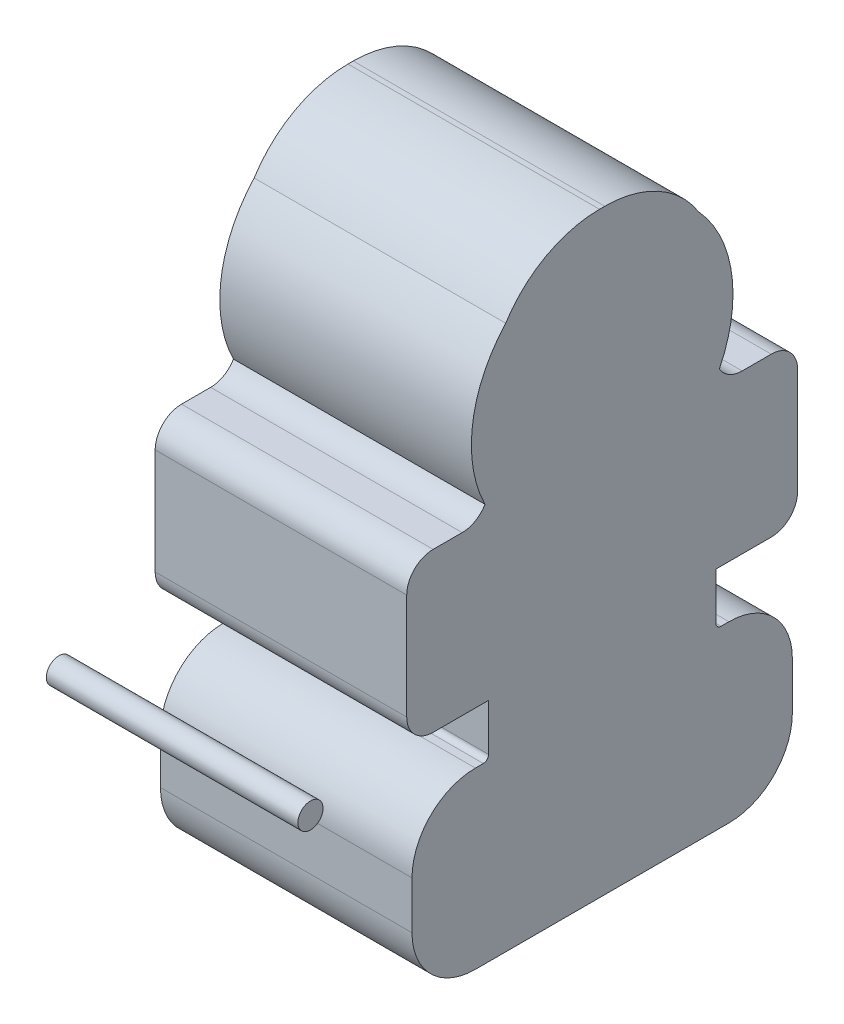
from build123d import *

# Parameters (mm, degrees)
SKETCH1_R             = 101.87
SKETCH1_R_2           = 11
BOSS_EXTRUDE1_DEPTH   = 2
CUT_EXTRUDE1_START    = -2
CUT_EXTRUDE1_DEPTH    = 2
CUT_EXTRUDE2_START    = -2
CUT_EXTRUDE2_DEPTH    = 2
SKETCH4_R             = 26
CUT_EXTRUDE3_DEPTH    = 2
SKETCH5_R             = 2.5
BOSS_EXTRUDE2_DEPTH   = 50
BOSS_EXTRUDE2_2_DEPTH = 50


# Read off the part's stored shape, not the designer's step: Cut-Extrude1, Cut-Extrude2
with BuildPart() as part:
    # Sketch1 → Boss-Extrude1 (new body)
    with BuildSketch(Plane(origin=(0, 0, 0), x_dir=(0, 0, -1), z_dir=(1, 0, 0))):
        Circle(SKETCH1_R)
        Circle(SKETCH1_R_2, mode=Mode.SUBTRACT)
    extrude(amount=BOSS_EXTRUDE1_DEPTH)

    # Cut-Extrude1 outline → Cut-Extrude1 (cut)
    with BuildSketch(Plane(origin=(2, 0, 0), x_dir=(0, 0, -1), z_dir=(1, 0, 0)).offset(CUT_EXTRUDE1_START)):
        with BuildLine():
            Line((96.83, 7.36), (96.83, 28.36))
            ThreePointArc((96.83, 28.36), (95.292310601, 32.072310601), (91.58, 33.61))
            Line((91.58, 33.61), (85.805, 33.61))
            ThreePointArc((85.805, 33.61), (82.092689399, 35.147689399), (80.555, 38.86))
            Line((80.555, 38.86), (80.555, 53.56))
            ThreePointArc((80.555, 53.56), (74.096704525, 69.151704525), (58.505, 75.61))
            Line((58.505, 75.61), (57.455, 75.61))
            ThreePointArc((57.455, 75.61), (41.863295475, 69.151704525), (35.405, 53.56))
            Line((35.405, 53.56), (35.405, 38.86))
            ThreePointArc((35.405, 38.86), (33.867310601, 35.147689399), (30.155, 33.61))
            Line((30.155, 33.61), (24.38, 33.61))
            ThreePointArc((24.38, 33.61), (20.667689399, 32.072310601), (19.13, 28.36))
            Line((19.13, 28.36), (19.13, 7.36))
            ThreePointArc((19.13, 7.36), (20.667689399, 3.647689399), (24.38, 2.11))
            Line((24.38, 2.11), (91.58, 2.11))
            ThreePointArc((91.58, 2.11), (95.292310601, 3.647689399), (96.83, 7.36))
        make_face()
    extrude(amount=CUT_EXTRUDE1_DEPTH, mode=Mode.SUBTRACT)

    # Cut-Extrude2 outline → Cut-Extrude2 (cut)
    with BuildSketch(Plane(origin=(2, 0, 0), x_dir=(0, 0, -1), z_dir=(1, 0, 0)).offset(CUT_EXTRUDE2_START)):
        with BuildLine():
            Line((80.555, 2.11), (35.405, 2.11))
            Line((35.405, 2.11), (35.405, -7.19))
            ThreePointArc((35.405, -7.19), (35.09746212, -7.93246212), (34.355, -8.24))
            Line((34.355, -8.24), (32.78, -8.24))
            ThreePointArc((32.78, -8.24), (23.870454557, -11.930454557), (20.18, -20.84))
            Line((20.18, -20.84), (20.18, -30.29))
            ThreePointArc((20.18, -30.29), (23.870454557, -39.199545443), (32.78, -42.89))
            Line((32.78, -42.89), (83.18, -42.89))
            ThreePointArc((83.18, -42.89), (92.089545443, -39.199545443), (95.78, -30.29))
            Line((95.78, -30.29), (95.78, -20.84))
            ThreePointArc((95.78, -20.84), (92.089545443, -11.930454557), (83.18, -8.24))
            Line((83.18, -8.24), (81.605, -8.24))
            ThreePointArc((81.605, -8.24), (80.86253788, -7.93246212), (80.555, -7.19))
            Line((80.555, -7.19), (80.555, 2.11))
        make_face()
    extrude(amount=CUT_EXTRUDE2_DEPTH, mode=Mode.SUBTRACT)

    # Sketch4 → Cut-Extrude3 (cut)
    with BuildSketch(Plane(origin=(2, 0, 0), x_dir=(0, 0, -1), z_dir=(1, 0, 0))):
        with Locations((57.98, 47.76331228)):
            Circle(SKETCH4_R)
    extrude(amount=-CUT_EXTRUDE3_DEPTH, mode=Mode.SUBTRACT)


with BuildPart() as body_2:
    # Sketch5 → Boss-Extrude2 (new body)
    with BuildSketch(Plane(origin=(2, 0, 0), x_dir=(0, 0, -1), z_dir=(1, 0, 0))):
        Circle(SKETCH5_R)
    extrude(amount=BOSS_EXTRUDE2_DEPTH)


with BuildPart() as body_3:
    # Sketch5 → Boss-Extrude2 2 (new body)
    with BuildSketch(Plane(origin=(2, 0, 0), x_dir=(0, 0, -1), z_dir=(1, 0, 0))):
        with BuildLine():
            ThreePointArc((81.272452679, 36.210752035), (83.724025312, 51.402702438), (77.157360564, 65.31975958))
            ThreePointArc((77.157360564, 65.31975958), (69.156286337, 72.866801894), (58.505, 75.61))
            Line((58.505, 75.61), (57.455, 75.61))
            ThreePointArc((57.455, 75.61), (46.803713663, 72.866801894), (38.802639436, 65.31975958))
            ThreePointArc((38.802639436, 65.31975958), (32.235974688, 51.402702438), (34.687547321, 36.210752035))
            ThreePointArc((34.687547321, 36.210752035), (32.767847889, 34.306372226), (30.155, 33.61))
            Line((30.155, 33.61), (24.38, 33.61))
            ThreePointArc((24.38, 33.61), (20.667689399, 32.072310601), (19.13, 28.36))
            Line((19.13, 28.36), (19.13, 7.36))
            ThreePointArc((19.13, 7.36), (20.667689399, 3.647689399), (24.38, 2.11))
            Line((24.38, 2.11), (35.405, 2.11))
            Line((35.405, 2.11), (35.405, -7.19))
            ThreePointArc((35.405, -7.19), (35.09746212, -7.93246212), (34.355, -8.24))
            Line((34.355, -8.24), (32.78, -8.24))
            ThreePointArc((32.78, -8.24), (23.870454557, -11.930454557), (20.18, -20.84))
            Line((20.18, -20.84), (20.18, -30.29))
            ThreePointArc((20.18, -30.29), (23.870454557, -39.199545443), (32.78, -42.89))
            Line((32.78, -42.89), (83.18, -42.89))
            ThreePointArc((83.18, -42.89), (92.089545443, -39.199545443), (95.78, -30.29))
            Line((95.78, -30.29), (95.78, -20.84))
            ThreePointArc((95.78, -20.84), (92.089545443, -11.930454557), (83.18, -8.24))
            Line((83.18, -8.24), (81.605, -8.24))
            ThreePointArc((81.605, -8.24), (80.86253788, -7.93246212), (80.555, -7.19))
            Line((80.555, -7.19), (80.555, 2.11))
            Line((80.555, 2.11), (91.58, 2.11))
            ThreePointArc((91.58, 2.11), (95.292310601, 3.647689399), (96.83, 7.36))
            Line((96.83, 7.36), (96.83, 28.36))
            ThreePointArc((96.83, 28.36), (95.292310601, 32.072310601), (91.58, 33.61))
            Line((91.58, 33.61), (85.805, 33.61))
            ThreePointArc((85.805, 33.61), (83.192152111, 34.306372226), (81.272452679, 36.210752035))
        make_face()
    extrude(amount=BOSS_EXTRUDE2_2_DEPTH)


solid = Compound([body_2.part, body_3.part])
